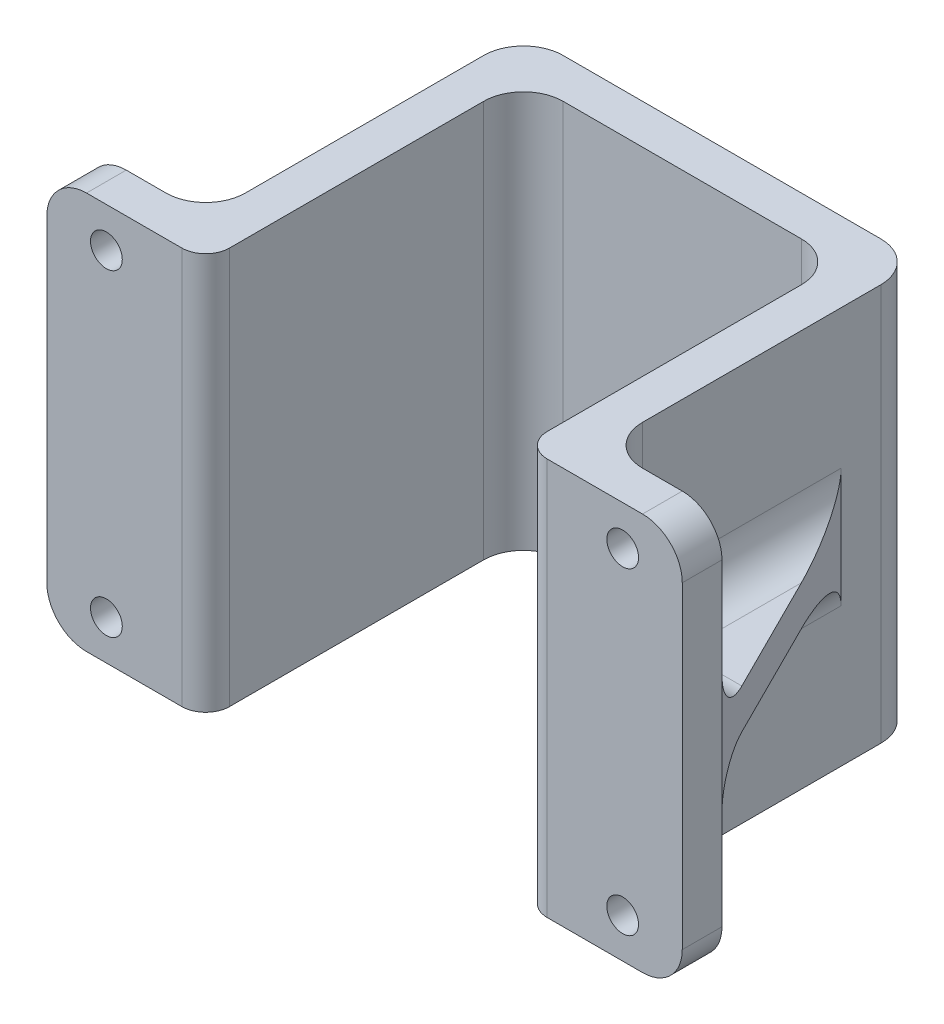
from build123d import *

# Parameters (mm, degrees)
BOSS_EXTRUDE1_DEPTH = 25
FILLET1_R           = 5
SKETCH2_R           = 2
CUT_EXTRUDE1_DEPTH  = 5
FILLET2_R           = 5
BOSS_EXTRUDE2_DEPTH = 2.5
FILLET3_R           = 5
FILLET4_R           = 3


with BuildPart() as part:
    # Sketch1 → Boss-Extrude1 (new, symmetric)
    with BuildSketch(Plane(origin=(0, 0, 0), x_dir=(1, 0, 0), z_dir=(0, 1, 0))):
        Polygon((-40, 0), (-20, 0), (-20, 40), (20, 40), (20, 0), (40, 0), (40, 5), (25, 5), (25, 45), (-25, 45), (-25, 5), (-40, 5), align=None)
    extrude(amount=BOSS_EXTRUDE1_DEPTH, both=True)

    # Fillet1
    fillet1_edges = [part.edges().sort_by_distance(p)[0] for p in [
        (-25, 0, -5),
        (-25, 0, -45),
        (25, 0, -45),
        (25, 0, -5),
        (20, 0, -40),
        (-20, 0, -40),
    ]]
    fillet(fillet1_edges, radius=FILLET1_R)

    # Sketch2 → Cut-Extrude1 (cut)
    with BuildSketch(Plane.XY):
        with Locations((-32.5, 20)):
            Circle(SKETCH2_R)
        with Locations((-32.5, -20)):
            Circle(SKETCH2_R)
        with Locations((32.5, -20)):
            Circle(SKETCH2_R)
        with Locations((32.5, 20)):
            Circle(SKETCH2_R)
    extrude(amount=-CUT_EXTRUDE1_DEPTH, mode=Mode.SUBTRACT)

    # Fillet2
    fillet2_edges = [part.edges().sort_by_distance(p)[0] for p in [
        (40, -25, -2.5),
        (-40, -25, -2.5),
        (40, 25, -2.5),
        (-40, 25, -2.5),
    ]]
    fillet(fillet2_edges, radius=FILLET2_R)

    # Sketch3 → Boss-Extrude2 (add, symmetric)
    with BuildSketch(Plane(origin=(0, 0, 0), x_dir=(1, 0, 0), z_dir=(0, 1, 0))):
        Polygon((-40, 5), (-25, 35), (-25, 5), align=None)
    boss_extrude2 = extrude(amount=BOSS_EXTRUDE2_DEPTH, both=True)

    # Mirror5: Boss-Extrude2 across plane
    add(boss_extrude2.mirror(Plane(origin=(0, 0, 0), x_dir=(0, 0, 1), z_dir=(1, 0, 0))))

    # Fillet3
    # the kernel refuses this fillet: 5 mm, written as the material it adds along each edge
    with BuildSketch(Plane(origin=(-30, -2.5, -10), x_dir=(1, 0, 0), z_dir=(0, 0, -1))) as fillet3_piece_1:
        with BuildLine():
            CenterArc((5 - FILLET3_R, FILLET3_R), FILLET3_R, 270, 90)
            Line((5 - FILLET3_R, 0), (5, 0))
            Line((5, 0), (5, FILLET3_R))
        make_face()
    revolve(axis=Axis((-30, -2.5, -10), (0, -1, 0)), revolution_arc=90)
    with BuildSketch(Plane(origin=(-30, 2.5, -10), x_dir=(1, 0, 0), z_dir=(0, 0, -1))) as fillet3_piece_2:
        with BuildLine():
            CenterArc((5 - FILLET3_R, -FILLET3_R), FILLET3_R, 0, 90)
            Line((5 - FILLET3_R, 0), (5, 0))
            Line((5, 0), (5, -FILLET3_R))
        make_face()
    revolve(axis=Axis((-30, 2.5, -10), (0, -1, 0)), revolution_arc=90)
    with BuildSketch(Plane(origin=(-25, -2.5, -47.5), x_dir=(-1, 0, 0), z_dir=(0, 0, 1))) as fillet3_piece_3_section:
        with BuildLine():
            CenterArc((FILLET3_R, FILLET3_R), FILLET3_R, 180, 90)
            Line((0, FILLET3_R), (0, 0))
            Line((0, 0), (FILLET3_R, 0))
        make_face()
    fillet3_piece_3 = extrude(amount=37.5, mode=Mode.PRIVATE)
    fillet3_piece_3 = split(fillet3_piece_3, bisect_by=Plane(origin=(-30.617859864, -3.692357018, -23.764280273), z_dir=(0.894427190999916, 0, 0.44721359549995787)), keep=Keep.TOP, mode=Mode.PRIVATE)
    add(fillet3_piece_3)
    with BuildSketch(Plane(origin=(-25, 2.5, -47.5), x_dir=(0, 1, 0), z_dir=(0, 0, 1))) as fillet3_piece_4_section:
        with BuildLine():
            CenterArc((FILLET3_R, FILLET3_R), FILLET3_R, 180, 90)
            Line((0, FILLET3_R), (0, 0))
            Line((0, 0), (FILLET3_R, 0))
        make_face()
    fillet3_piece_4 = extrude(amount=37.5, mode=Mode.PRIVATE)
    fillet3_piece_4 = split(fillet3_piece_4, bisect_by=Plane(origin=(-30.617859864, 3.692357018, -23.764280273), z_dir=(0.894427190999916, 0, 0.44721359549995787)), keep=Keep.TOP, mode=Mode.PRIVATE)
    add(fillet3_piece_4)
    with BuildSketch(Plane(origin=(-30, 2.5, -5), x_dir=(0, 1, 0), z_dir=(-1, 0, 0))) as fillet3_piece_5_section:
        with BuildLine():
            CenterArc((FILLET3_R, FILLET3_R), FILLET3_R, 180, 90)
            Line((0, FILLET3_R), (0, 0))
            Line((0, 0), (FILLET3_R, 0))
        make_face()
    fillet3_piece_5 = extrude(amount=10, mode=Mode.PRIVATE)
    fillet3_piece_5 = split(fillet3_piece_5, bisect_by=Plane(origin=(-38.518002001, 3.668083757, -7.963995998), z_dir=(0.894427190999916, 0, 0.44721359549995787)), keep=Keep.TOP, mode=Mode.PRIVATE)
    add(fillet3_piece_5)
    with BuildSketch(Plane(origin=(-30, -2.5, -5), x_dir=(0, -1, 0), z_dir=(-1, 0, 0))) as fillet3_piece_6_section:
        with BuildLine():
            CenterArc((FILLET3_R, -FILLET3_R), FILLET3_R, 90, 90)
            Line((0, -FILLET3_R), (0, 0))
            Line((0, 0), (FILLET3_R, 0))
        make_face()
    fillet3_piece_6 = extrude(amount=10, mode=Mode.PRIVATE)
    fillet3_piece_6 = split(fillet3_piece_6, bisect_by=Plane(origin=(-38.518002001, -3.668083757, -7.963995998), z_dir=(0.894427190999916, 0, 0.44721359549995787)), keep=Keep.TOP, mode=Mode.PRIVATE)
    add(fillet3_piece_6)
    with BuildSketch(Plane(origin=(30, -2.5, -10), x_dir=(-1, 0, 0), z_dir=(0, 0, -1))) as fillet3_piece_7:
        with BuildLine():
            CenterArc((5 - FILLET3_R, -FILLET3_R), FILLET3_R, 0, 90)
            Line((5 - FILLET3_R, 0), (5, 0))
            Line((5, 0), (5, -FILLET3_R))
        make_face()
    revolve(axis=Axis((30, -2.5, -10), (0, 1, 0)), revolution_arc=90)
    with BuildSketch(Plane(origin=(30, 2.5, -10), x_dir=(-1, 0, 0), z_dir=(0, 0, -1))) as fillet3_piece_8:
        with BuildLine():
            CenterArc((5 - FILLET3_R, FILLET3_R), FILLET3_R, 270, 90)
            Line((5, FILLET3_R), (5, 0))
            Line((5, 0), (5 - FILLET3_R, 0))
        make_face()
    revolve(axis=Axis((30, 2.5, -10), (0, 1, 0)), revolution_arc=90)
    with BuildSketch(Plane(origin=(25, 2.5, -47.5), x_dir=(0, 1, 0), z_dir=(0, 0, 1))) as fillet3_piece_9_section:
        with BuildLine():
            CenterArc((FILLET3_R, -FILLET3_R), FILLET3_R, 90, 90)
            Line((0, -FILLET3_R), (0, 0))
            Line((0, 0), (FILLET3_R, 0))
        make_face()
    fillet3_piece_9 = extrude(amount=37.5, mode=Mode.PRIVATE)
    fillet3_piece_9 = split(fillet3_piece_9, bisect_by=Plane(origin=(30.617859864, 3.692357018, -23.764280273), z_dir=(-0.894427190999916, 0, 0.44721359549995787)), keep=Keep.TOP, mode=Mode.PRIVATE)
    add(fillet3_piece_9)
    with BuildSketch(Plane(origin=(30, -2.5, -5), x_dir=(0, -1, 0), z_dir=(1, 0, 0))) as fillet3_piece_10_section:
        with BuildLine():
            CenterArc((FILLET3_R, FILLET3_R), FILLET3_R, 180, 90)
            Line((0, FILLET3_R), (0, 0))
            Line((0, 0), (FILLET3_R, 0))
        make_face()
    fillet3_piece_10 = extrude(amount=10, mode=Mode.PRIVATE)
    fillet3_piece_10 = split(fillet3_piece_10, bisect_by=Plane(origin=(38.518002001, -3.668083757, -7.963995998), z_dir=(-0.894427190999916, 0, 0.44721359549995787)), keep=Keep.TOP, mode=Mode.PRIVATE)
    add(fillet3_piece_10)
    with BuildSketch(Plane(origin=(25, -2.5, -47.5), x_dir=(0, -1, 0), z_dir=(0, 0, 1))) as fillet3_piece_11_section:
        with BuildLine():
            CenterArc((FILLET3_R, FILLET3_R), FILLET3_R, 180, 90)
            Line((0, FILLET3_R), (0, 0))
            Line((0, 0), (FILLET3_R, 0))
        make_face()
    fillet3_piece_11 = extrude(amount=37.5, mode=Mode.PRIVATE)
    fillet3_piece_11 = split(fillet3_piece_11, bisect_by=Plane(origin=(30.617859864, -3.692357018, -23.764280273), z_dir=(-0.894427190999916, 0, 0.44721359549995787)), keep=Keep.TOP, mode=Mode.PRIVATE)
    add(fillet3_piece_11)
    with BuildSketch(Plane(origin=(30, 2.5, -5), x_dir=(0, 0, -1), z_dir=(1, 0, 0))) as fillet3_piece_12_section:
        with BuildLine():
            CenterArc((FILLET3_R, FILLET3_R), FILLET3_R, 180, 90)
            Line((0, FILLET3_R), (0, 0))
            Line((0, 0), (FILLET3_R, 0))
        make_face()
    fillet3_piece_12 = extrude(amount=10, mode=Mode.PRIVATE)
    fillet3_piece_12 = split(fillet3_piece_12, bisect_by=Plane(origin=(38.518002001, 3.668083757, -7.963995998), z_dir=(-0.894427190999916, 0, 0.44721359549995787)), keep=Keep.TOP, mode=Mode.PRIVATE)
    add(fillet3_piece_12)

    # Fillet4
    fillet4_edges = [part.edges().sort_by_distance(p)[0] for p in [
        (20, 0, 0),
        (-20, 0, 0),
    ]]
    fillet(fillet4_edges, radius=FILLET4_R)


solid = part.part
